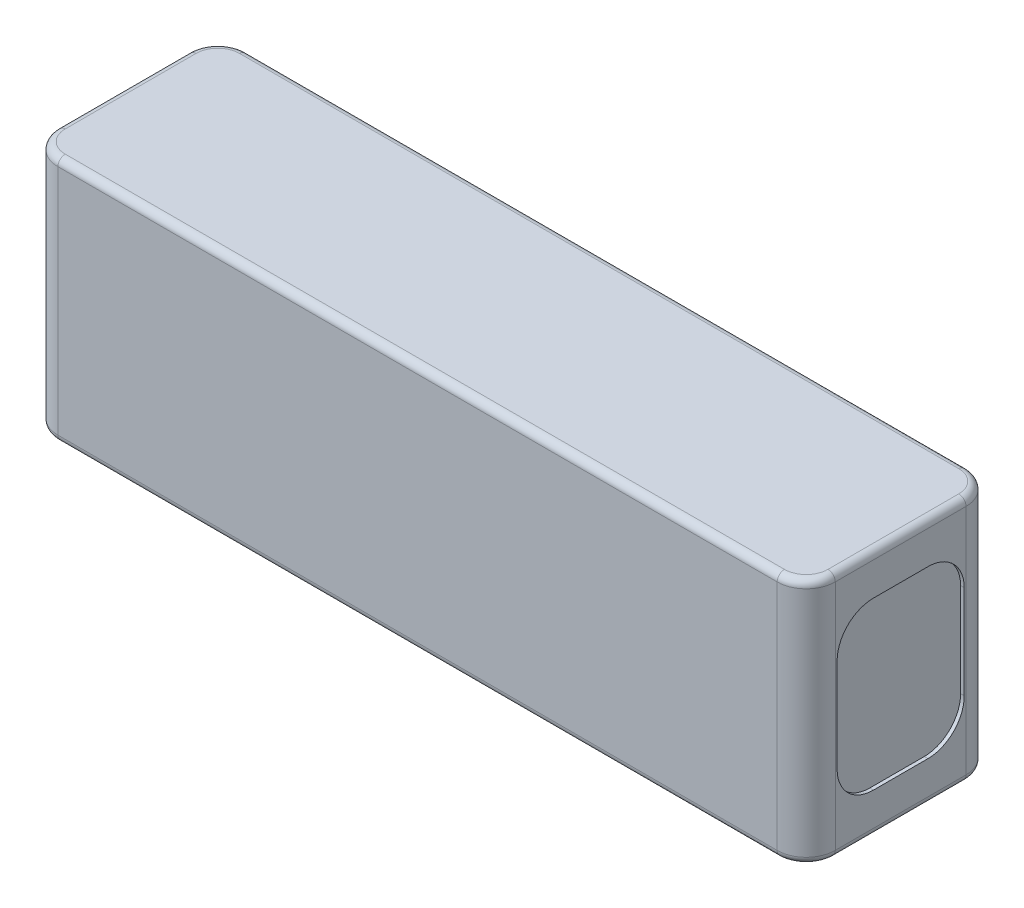
from build123d import *

# Parameters (mm, degrees)
SKETCH1_W           = 107
SKETCH1_H           = 34
BOSS_EXTRUDE1_DEPTH = 26
CUT_EXTRUDE1_DEPTH  = 0.5
CUT_EXTRUDE2_DEPTH  = 0.5
FILLET1_R           = 4
FILLET2_R           = 1


with BuildPart() as part:
    # Sketch1 → Boss-Extrude1 (new body)
    with BuildSketch(Plane(origin=(0, 0, -15), x_dir=(-1, 0, 0), z_dir=(0, 0, -1))):
        with Locations((-15.5, -5)):
            Rectangle(SKETCH1_W, SKETCH1_H)
    extrude(amount=-BOSS_EXTRUDE1_DEPTH)

    # Sketch2 → Cut-Extrude1 (cut)
    with BuildSketch(Plane(origin=(69, 0, 0), x_dir=(0, 0, -1), z_dir=(1, 0, 0))):
        with BuildLine():
            Line((-6.75, 1.442307692), (-6.75, -11.442307692))
            ThreePointArc((-6.75, -11.442307692), (-5.285533906, -14.977841598), (-1.75, -16.442307692))
            Line((-1.75, -16.442307692), (5.75, -16.442307692))
            ThreePointArc((5.75, -16.442307692), (9.285533906, -14.977841598), (10.75, -11.442307692))
            Line((10.75, -11.442307692), (10.75, 1.442307692))
            ThreePointArc((10.75, 1.442307692), (9.285533906, 4.977841598), (5.75, 6.442307692))
            Line((5.75, 6.442307692), (-1.75, 6.442307692))
            ThreePointArc((-1.75, 6.442307692), (-5.285533906, 4.977841598), (-6.75, 1.442307692))
        make_face()
    extrude(amount=-CUT_EXTRUDE1_DEPTH, mode=Mode.SUBTRACT)

    # Sketch3 → Cut-Extrude2 (cut)
    with BuildSketch(Plane.ZY.offset(38)):
        with BuildLine():
            Line((-0.625, 7.259615385), (-3.375, 7.259615385))
            ThreePointArc((-3.375, 7.259615385), (-9.031854249, 4.916469634), (-11.375, -0.740384615))
            Line((-11.375, -0.740384615), (-11.375, -9.259615385))
            ThreePointArc((-11.375, -9.259615385), (-9.031854249, -14.916469634), (-3.375, -17.259615385))
            Line((-3.375, -17.259615385), (-0.625, -17.259615385))
            ThreePointArc((-0.625, -17.259615385), (5.031854249, -14.916469634), (7.375, -9.259615385))
            Line((7.375, -9.259615385), (7.375, -0.740384615))
            ThreePointArc((7.375, -0.740384615), (5.031854249, 4.916469634), (-0.625, 7.259615385))
        make_face()
    extrude(amount=-CUT_EXTRUDE2_DEPTH, mode=Mode.SUBTRACT)

    # Fillet1
    # the kernel refuses this fillet: 4 mm, written as the material it takes off along each edge
    with BuildSketch(Plane(origin=(-38, -32, -15), x_dir=(0, 0, 1), z_dir=(0, 1, 0)), Plane(origin=(69, 22, -15), x_dir=(0, 0, 1), z_dir=(0, -1, 0))) as fillet1_piece_1:
        with BuildLine():
            CenterArc((FILLET1_R, FILLET1_R), FILLET1_R, 180, 90)
            Line((0, FILLET1_R), (0, 0))
            Line((0, 0), (FILLET1_R, 0))
        make_face()
    extrude(amount=54, mode=Mode.SUBTRACT)
    with BuildSketch(Plane(origin=(-38, -32, 11), x_dir=(0, 0, -1), z_dir=(0, 1, 0)), Plane(origin=(69, 22, 11), x_dir=(0, 0, -1), z_dir=(0, -1, 0))) as fillet1_piece_2:
        with BuildLine():
            CenterArc((FILLET1_R, -FILLET1_R), FILLET1_R, 90, 90)
            Line((0, -FILLET1_R), (0, 0))
            Line((0, 0), (FILLET1_R, 0))
        make_face()
    extrude(amount=54, mode=Mode.SUBTRACT)

    # Fillet2
    fillet2_edges = [part.edges().sort_by_distance(p)[0] for p in [
        (15.5, -22, -15),
        (15.5, 12, -15),
        (-38, 12, -2),
        (15.5, 12, 11),
        (69, 12, -2),
        (67.828427125, 12, 9.828427125),
        (67.828427125, 12, -13.828427125),
        (-36.828427125, 12, 9.828427125),
        (-36.828427125, 12, -13.828427125),
        (-38, -22, -2),
        (69, -22, -2),
        (15.5, -22, 11),
        (67.828427125, -22, 9.828427125),
        (67.828427125, -22, -13.828427125),
        (-36.828427125, -22, 9.828427125),
        (-36.828427125, -22, -13.828427125),
    ]]
    fillet(fillet2_edges, radius=FILLET2_R)


solid = part.part
